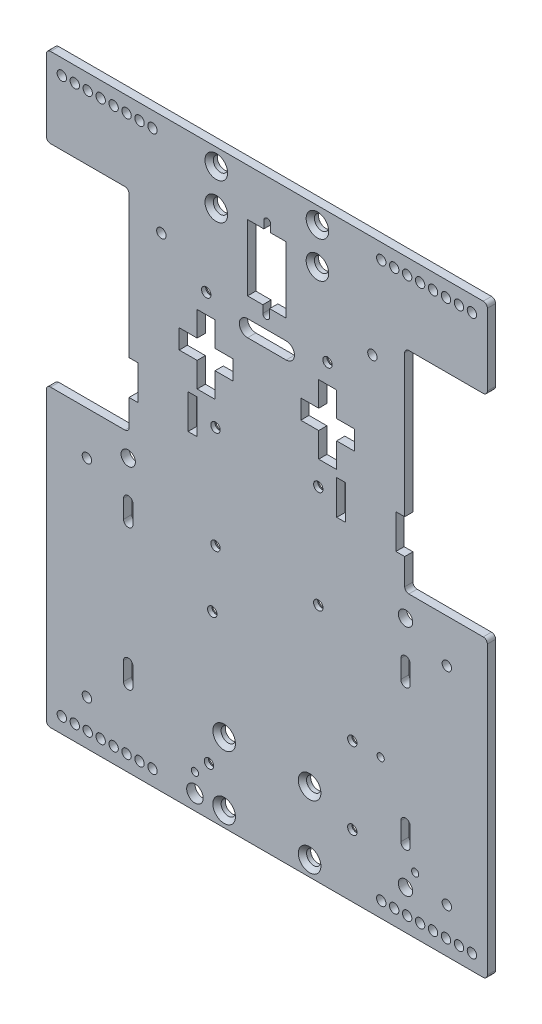
from build123d import *

# Parameters (mm, degrees)
BOSS_EXTRUDE1_DEPTH = 3
SKETCH2_R           = 1.7
CUT_EXTRUDE1_DEPTH  = 3
SKETCH3_R           = 1.7
CUT_EXTRUDE2_DEPTH  = 3
SKETCH4_R           = 1.7
CUT_EXTRUDE3_DEPTH  = 3
CUT_EXTRUDE6_DEPTH  = 3
FILLET1_R           = 1.5
FILLET2_R           = 1.5
SKETCH7_R           = 2.6
CUT_EXTRUDE7_DEPTH  = 3
SKETCH8_W           = 3.2
SKETCH8_H           = 12.5
CUT_EXTRUDE9_DEPTH  = 3
SKETCH9_W           = 3.25
SKETCH9_H           = 12.5
CUT_EXTRUDE10_DEPTH = 3
CUT_EXTRUDE12_DEPTH = 3
SKETCH11_R          = 1.7
CUT_EXTRUDE14_DEPTH = 3
SKETCH12_R          = 1.7
CUT_EXTRUDE16_DEPTH = 3
SKETCH13_R          = 1.7
CUT_EXTRUDE18_DEPTH = 3
SKETCH14_R          = 1.3
CUT_EXTRUDE20_DEPTH = 3
SKETCH15_R          = 2.6
CUT_EXTRUDE21_DEPTH = 10
SKETCH16_R          = 3
SKETCH16_R_2        = 1.3
CUT_EXTRUDE24_DEPTH = 10
CHAMFER1_SIZE       = 1.5
CHAMFER2_SIZE       = 1.5
CHAMFER3_SIZE       = 1.5
CHAMFER4_SIZE       = 1.5
CHAMFER5_SIZE       = 1.5
CHAMFER6_SIZE       = 1.5
CHAMFER7_SIZE       = 1.5
CHAMFER8_SIZE       = 1.5
CHAMFER9_SIZE       = 1.5
CHAMFER10_SIZE      = 1.5
CHAMFER11_SIZE      = 1.5
CHAMFER12_SIZE      = 1.5
SKETCH17_R          = 2.6
CUT_EXTRUDE27_DEPTH = 10
FILLET3_R           = 1.5
FILLET4_R           = 1.5
CHAMFER13_SIZE      = 1.5
CHAMFER14_SIZE      = 1.5
CHAMFER15_SIZE      = 1.5
CHAMFER16_SIZE      = 1.5
CHAMFER17_SIZE      = 1.5
CHAMFER18_SIZE      = 1.5
FILLET5_R           = 1.5
FILLET6_R           = 1.5
FILLET7_R           = 1.5
FILLET8_R           = 1.5


with BuildPart() as part:
    # Sketch1 → Boss-Extrude1 (new body)
    with BuildSketch(Plane.XY):
        Polygon((-80, -100.362745098), (80, -100.362745098), (80, 6.637254902), (50, 6.637254902), (50, 83.137254902), (80, 83.137254902), (80, 112.137254902), (-80, 112.137254902), (-80, 83.137254902), (-50, 83.137254902), (-50, 6.637254902), (-80, 6.637254902), align=None)
    extrude(amount=BOSS_EXTRUDE1_DEPTH)

    # Sketch2 → Cut-Extrude1 (cut)
    with BuildSketch(Plane(origin=(0, 0, 0), x_dir=(-1, 0, 0), z_dir=(0, 0, -1))):
        with Locations((38.27958447, 75.137254902)):
            Circle(SKETCH2_R)
        with Locations((-38.27958447, 75.137254902)):
            Circle(SKETCH2_R)
        with BuildLine():
            Line((-7, 95.04531444), (-1.373901732, 95.04531444))
            Line((-1.373901732, 95.04531444), (-1.373901732, 97.778273136))
            ThreePointArc((-1.373901732, 97.778273136), (-0.139792235, 99.012382633), (1.094317261, 97.778273136))
            Line((1.094317261, 97.778273136), (1.094317261, 95.04531444))
            Line((1.094317261, 95.04531444), (7, 95.04531444))
            Line((7, 95.04531444), (7, 71.04531444))
            Line((7, 71.04531444), (1.469744896, 71.04531444))
            Line((1.469744896, 71.04531444), (1.469744896, 68.312355743))
            ThreePointArc((1.469744896, 68.312355743), (0.235635399, 67.078246247), (-0.998474097, 68.312355743))
            Line((-0.998474097, 68.312355743), (-0.998474097, 71.04531444))
            Line((-0.998474097, 71.04531444), (-7, 71.04531444))
            Line((-7, 71.04531444), (-7, 95.04531444))
        make_face()
    extrude(amount=-CUT_EXTRUDE1_DEPTH, mode=Mode.SUBTRACT)

    # Sketch3 → Cut-Extrude2 (cut)
    with BuildSketch(Plane.XY.offset(3)):
        with Locations((-22, 64.68040086)):
            Circle(SKETCH3_R)
        with Locations((22, 64.68040086)):
            Circle(SKETCH3_R)
        with BuildLine():
            Line((-7, 63.896376565), (7, 63.896376565))
            ThreePointArc((7, 63.896376565), (10, 60.896376565), (7, 57.896376565))
            Line((7, 57.896376565), (-7, 57.896376565))
            ThreePointArc((-7, 57.896376565), (-10, 60.896376565), (-7, 63.896376565))
        make_face()
    extrude(amount=-CUT_EXTRUDE2_DEPTH, mode=Mode.SUBTRACT)

    # Sketch4 → Cut-Extrude3 (cut)
    with BuildSketch(Plane.XY.offset(3)):
        with Locations((74.4, 106.537254902)):
            Circle(SKETCH4_R)
        with Locations((69.7, 106.537254902)):
            Circle(SKETCH4_R)
        with Locations((65, 106.537254902)):
            Circle(SKETCH4_R)
        with Locations((60.3, 106.537254902)):
            Circle(SKETCH4_R)
        with Locations((55.6, 106.537254902)):
            Circle(SKETCH4_R)
        with Locations((50.9, 106.537254902)):
            Circle(SKETCH4_R)
        with Locations((46.2, 106.537254902)):
            Circle(SKETCH4_R)
        with Locations((41.5, 106.537254902)):
            Circle(SKETCH4_R)
        with Locations((-74.4, 106.537254902)):
            Circle(SKETCH4_R)
        with Locations((-69.7, 106.537254902)):
            Circle(SKETCH4_R)
        with Locations((-65, 106.537254902)):
            Circle(SKETCH4_R)
        with Locations((-60.3, 106.537254902)):
            Circle(SKETCH4_R)
        with Locations((-55.6, 106.537254902)):
            Circle(SKETCH4_R)
        with Locations((-50.9, 106.537254902)):
            Circle(SKETCH4_R)
        with Locations((-46.2, 106.537254902)):
            Circle(SKETCH4_R)
        with Locations((-41.5, 106.537254902)):
            Circle(SKETCH4_R)
        with Locations((-74.4, -94.762745098)):
            Circle(SKETCH4_R)
        with Locations((-69.7, -94.762745098)):
            Circle(SKETCH4_R)
        with Locations((-65, -94.762745098)):
            Circle(SKETCH4_R)
        with Locations((-60.3, -94.762745098)):
            Circle(SKETCH4_R)
        with Locations((-55.6, -94.762745098)):
            Circle(SKETCH4_R)
        with Locations((-50.9, -94.762745098)):
            Circle(SKETCH4_R)
        with Locations((-46.2, -94.762745098)):
            Circle(SKETCH4_R)
        with Locations((-41.5, -94.762745098)):
            Circle(SKETCH4_R)
        with Locations((41.5, -94.762745098)):
            Circle(SKETCH4_R)
        with Locations((46.2, -94.762745098)):
            Circle(SKETCH4_R)
        with Locations((50.9, -94.762745098)):
            Circle(SKETCH4_R)
        with Locations((55.6, -94.762745098)):
            Circle(SKETCH4_R)
        with Locations((60.3, -94.762745098)):
            Circle(SKETCH4_R)
        with Locations((65, -94.762745098)):
            Circle(SKETCH4_R)
        with Locations((69.7, -94.762745098)):
            Circle(SKETCH4_R)
        with Locations((74.4, -94.762745098)):
            Circle(SKETCH4_R)
    extrude(amount=-CUT_EXTRUDE3_DEPTH, mode=Mode.SUBTRACT)

    # Sketch6 → Cut-Extrude6 (cut)
    with BuildSketch(Plane.XY):
        Polygon((25.3, 57.637254902), (18.8, 57.637254902), (18.8, 48.637254902), (12.3, 48.637254902), (12.3, 41.637254902), (18.8, 41.637254902), (18.8, 32.637254902), (25.3, 32.637254902), (25.3, 41.637254902), (31.8, 41.637254902), (31.8, 48.637254902), (25.3, 48.637254902), align=None)
        Polygon((-31.8, 48.637254902), (-25.3, 48.637254902), (-25.3, 57.637254902), (-18.8, 57.637254902), (-18.8, 48.637254902), (-12.3, 48.637254902), (-12.3, 41.637254902), (-18.8, 41.637254902), (-18.8, 32.637254902), (-25.3, 32.637254902), (-25.3, 41.637254902), (-31.8, 41.637254902), align=None)
    extrude(amount=CUT_EXTRUDE6_DEPTH, mode=Mode.SUBTRACT)

    # Fillet1
    fillet1_edges = [part.edges().sort_by_distance(p)[0] for p in [
        (80, 83.137254902, 1.5),
        (80, 112.137254902, 1.5),
        (-80, 112.137254902, 1.5),
        (-80, 83.137254902, 1.5),
    ]]
    fillet(fillet1_edges, radius=FILLET1_R)

    # Fillet2
    fillet2_edges = [part.edges().sort_by_distance(p)[0] for p in [
        (80, -100.362745098, 1.5),
        (-80, -100.362745098, 1.5),
    ]]
    fillet(fillet2_edges, radius=FILLET2_R)

    # Sketch7 → Cut-Extrude7 (cut)
    with BuildSketch(Plane.XY.offset(3)):
        with Locations((-15.5, -94.862745098)):
            Circle(SKETCH7_R)
        with Locations((-15.5, -71.862745098)):
            Circle(SKETCH7_R)
        with Locations((15.5, -94.862745098)):
            Circle(SKETCH7_R)
        with Locations((15.5, -71.862745098)):
            Circle(SKETCH7_R)
    extrude(amount=-CUT_EXTRUDE7_DEPTH, mode=Mode.SUBTRACT)

    # Sketch8 → Cut-Extrude9 (cut)
    with BuildSketch(Plane.XY):
        with Locations((-48.4, 23.887254902)):
            Rectangle(SKETCH8_W, SKETCH8_H)
        with Locations((48.4, 23.887254902)):
            Rectangle(SKETCH8_W, SKETCH8_H)
    extrude(amount=CUT_EXTRUDE9_DEPTH, mode=Mode.SUBTRACT)

    # Sketch9 → Cut-Extrude10 (cut)
    with BuildSketch(Plane.XY.offset(3)):
        with Locations((-26.975, 23.887254902)):
            Rectangle(SKETCH9_W, SKETCH9_H)
        with Locations((26.975, 23.887254902)):
            Rectangle(SKETCH9_W, SKETCH9_H)
    extrude(amount=-CUT_EXTRUDE10_DEPTH, mode=Mode.SUBTRACT)

    # Sketch10 → Cut-Extrude12 (cut)
    with BuildSketch(Plane.XY):
        with BuildLine():
            Line((-48.6, -15.062745098), (-48.6, -21.662745098))
            ThreePointArc((-48.6, -21.662745098), (-50.3, -23.362745098), (-52, -21.662745098))
            Line((-52, -21.662745098), (-52, -15.062745098))
            ThreePointArc((-52, -15.062745098), (-50.3, -13.362745098), (-48.6, -15.062745098))
        make_face()
        with BuildLine():
            Line((-52, -66.062745098), (-52, -72.662745098))
            ThreePointArc((-52, -72.662745098), (-50.3, -74.362745098), (-48.6, -72.662745098))
            Line((-48.6, -72.662745098), (-48.6, -66.062745098))
            ThreePointArc((-48.6, -66.062745098), (-50.3, -64.362745098), (-52, -66.062745098))
        make_face()
        with BuildLine():
            Line((48.6, -66.062745098), (48.6, -72.662745098))
            ThreePointArc((48.6, -72.662745098), (50.3, -74.362745098), (52, -72.662745098))
            Line((52, -72.662745098), (52, -66.062745098))
            ThreePointArc((52, -66.062745098), (50.3, -64.362745098), (48.6, -66.062745098))
        make_face()
        with BuildLine():
            Line((48.6, -15.062745098), (48.6, -21.662745098))
            ThreePointArc((48.6, -21.662745098), (50.3, -23.362745098), (52, -21.662745098))
            Line((52, -21.662745098), (52, -15.062745098))
            ThreePointArc((52, -15.062745098), (50.3, -13.362745098), (48.6, -15.062745098))
        make_face()
    extrude(amount=CUT_EXTRUDE12_DEPTH, mode=Mode.SUBTRACT)

    # Sketch11 → Cut-Extrude14 (cut)
    with BuildSketch(Plane.XY):
        with Locations((-18.65, 23.887254902)):
            Circle(SKETCH11_R)
        with Locations((-18.65, -13.312745098)):
            Circle(SKETCH11_R)
        with Locations((18.65, -13.312745098)):
            Circle(SKETCH11_R)
        with Locations((18.65, 23.887254902)):
            Circle(SKETCH11_R)
    extrude(amount=CUT_EXTRUDE14_DEPTH, mode=Mode.SUBTRACT)

    # Sketch12 → Cut-Extrude16 (cut)
    with BuildSketch(Plane.XY):
        with Locations((65.3, -9.062745098)):
            Circle(SKETCH12_R)
        with Locations((-65.3, -9.062745098)):
            Circle(SKETCH12_R)
        with Locations((65.3, -84.162745098)):
            Circle(SKETCH12_R)
        with Locations((-65.3, -84.162745098)):
            Circle(SKETCH12_R)
    extrude(amount=CUT_EXTRUDE16_DEPTH, mode=Mode.SUBTRACT)

    # Sketch13 → Cut-Extrude18 (cut)
    with BuildSketch(Plane.XY):
        with Locations((-21, -82.862745098)):
            Circle(SKETCH13_R)
        with Locations((31, -77.662745098)):
            Circle(SKETCH13_R)
        with Locations((31, -49.762745098)):
            Circle(SKETCH13_R)
        with Locations((-19.8, -34.562745098)):
            Circle(SKETCH13_R)
    extrude(amount=CUT_EXTRUDE18_DEPTH, mode=Mode.SUBTRACT)

    # Sketch14 → Cut-Extrude20 (cut)
    with BuildSketch(Plane.XY):
        with Locations((53.8, -79.762745098)):
            Circle(SKETCH14_R)
        with Locations((41.3, -49.762745098)):
            Circle(SKETCH14_R)
    extrude(amount=CUT_EXTRUDE20_DEPTH, mode=Mode.SUBTRACT)

    # Sketch15 → Cut-Extrude21 (cut)
    with BuildSketch(Plane.XY):
        with Locations((50.3, -1.562745098)):
            Circle(SKETCH15_R)
        with Locations((-50.3, -1.562745098)):
            Circle(SKETCH15_R)
        with Locations((50.3, -86.162745098)):
            Circle(SKETCH15_R)
    extrude(amount=CUT_EXTRUDE21_DEPTH, mode=Mode.SUBTRACT)

    # Sketch16 → Cut-Extrude24 (cut)
    with BuildSketch(Plane.XY.offset(3)):
        with Locations((-26.1, -94.862745098)):
            Circle(SKETCH16_R)
        with Locations((-26.1, -88.062745098)):
            Circle(SKETCH16_R_2)
    extrude(amount=-CUT_EXTRUDE24_DEPTH, mode=Mode.SUBTRACT)

    # Chamfer1
    chamfer1_edges = [part.edges().sort_by_distance(p)[0] for p in [
        (-18.1, -71.862745098, 3),
    ]]
    chamfer(chamfer1_edges, length=CHAMFER1_SIZE)

    # Chamfer2
    chamfer2_edges = [part.edges().sort_by_distance(p)[0] for p in [
        (12.9, -71.862745098, 3),
    ]]
    chamfer(chamfer2_edges, length=CHAMFER2_SIZE)

    # Chamfer3
    chamfer3_edges = [part.edges().sort_by_distance(p)[0] for p in [
        (-18.1, -94.862745098, 3),
    ]]
    chamfer(chamfer3_edges, length=CHAMFER3_SIZE)

    # Chamfer4
    chamfer4_edges = [part.edges().sort_by_distance(p)[0] for p in [
        (12.9, -94.862745098, 3),
    ]]
    chamfer(chamfer4_edges, length=CHAMFER4_SIZE)

    # Chamfer5
    chamfer5_edges = [part.edges().sort_by_distance(p)[0] for p in [
        (16.95, 23.887254902, 0),
    ]]
    chamfer(chamfer5_edges, length=CHAMFER5_SIZE)

    # Chamfer6
    chamfer6_edges = [part.edges().sort_by_distance(p)[0] for p in [
        (-20.35, 23.887254902, 0),
    ]]
    chamfer(chamfer6_edges, length=CHAMFER6_SIZE)

    # Chamfer7
    chamfer7_edges = [part.edges().sort_by_distance(p)[0] for p in [
        (16.95, -13.312745098, 0),
    ]]
    chamfer(chamfer7_edges, length=CHAMFER7_SIZE)

    # Chamfer8
    chamfer8_edges = [part.edges().sort_by_distance(p)[0] for p in [
        (-20.35, -13.312745098, 0),
    ]]
    chamfer(chamfer8_edges, length=CHAMFER8_SIZE)

    # Chamfer9
    chamfer9_edges = [part.edges().sort_by_distance(p)[0] for p in [
        (-21.5, -34.562745098, 0),
    ]]
    chamfer(chamfer9_edges, length=CHAMFER9_SIZE)

    # Chamfer10
    chamfer10_edges = [part.edges().sort_by_distance(p)[0] for p in [
        (29.3, -49.762745098, 0),
    ]]
    chamfer(chamfer10_edges, length=CHAMFER10_SIZE)

    # Chamfer11
    chamfer11_edges = [part.edges().sort_by_distance(p)[0] for p in [
        (29.3, -77.662745098, 0),
    ]]
    chamfer(chamfer11_edges, length=CHAMFER11_SIZE)

    # Chamfer12
    chamfer12_edges = [part.edges().sort_by_distance(p)[0] for p in [
        (-22.7, -82.862745098, 0),
    ]]
    chamfer(chamfer12_edges, length=CHAMFER12_SIZE)

    # Sketch17 → Cut-Extrude27 (cut)
    with BuildSketch(Plane.XY):
        with Locations((-18.35, 106.037254902)):
            Circle(SKETCH17_R)
        with Locations((-18.35, 92.837254902)):
            Circle(SKETCH17_R)
        with Locations((18.35, 92.837254902)):
            Circle(SKETCH17_R)
        with Locations((18.35, 106.037254902)):
            Circle(SKETCH17_R)
    extrude(amount=CUT_EXTRUDE27_DEPTH, mode=Mode.SUBTRACT)

    # Fillet3
    fillet3_edges = [part.edges().sort_by_distance(p)[0] for p in [
        (80, 6.637254902, 1.5),
    ]]
    fillet(fillet3_edges, radius=FILLET3_R)

    # Fillet4
    fillet4_edges = [part.edges().sort_by_distance(p)[0] for p in [
        (-80, 6.637254902, 1.5),
    ]]
    fillet(fillet4_edges, radius=FILLET4_R)

    # Chamfer13
    chamfer13_edges = [part.edges().sort_by_distance(p)[0] for p in [
        (-20.95, 106.037254902, 3),
    ]]
    chamfer(chamfer13_edges, length=CHAMFER13_SIZE)

    # Chamfer14
    chamfer14_edges = [part.edges().sort_by_distance(p)[0] for p in [
        (15.75, 106.037254902, 3),
    ]]
    chamfer(chamfer14_edges, length=CHAMFER14_SIZE)

    # Chamfer15
    chamfer15_edges = [part.edges().sort_by_distance(p)[0] for p in [
        (-20.95, 92.837254902, 3),
    ]]
    chamfer(chamfer15_edges, length=CHAMFER15_SIZE)

    # Chamfer16
    chamfer16_edges = [part.edges().sort_by_distance(p)[0] for p in [
        (15.75, 92.837254902, 3),
    ]]
    chamfer(chamfer16_edges, length=CHAMFER16_SIZE)

    # Chamfer17
    chamfer17_edges = [part.edges().sort_by_distance(p)[0] for p in [
        (-23.7, 64.68040086, 0),
    ]]
    chamfer(chamfer17_edges, length=CHAMFER17_SIZE)

    # Chamfer18
    chamfer18_edges = [part.edges().sort_by_distance(p)[0] for p in [
        (20.3, 64.68040086, 0),
    ]]
    chamfer(chamfer18_edges, length=CHAMFER18_SIZE)

    # Fillet5
    fillet5_edges = [part.edges().sort_by_distance(p)[0] for p in [
        (50, 6.637254902, 1.5),
    ]]
    fillet(fillet5_edges, radius=FILLET5_R)

    # Fillet6
    fillet6_edges = [part.edges().sort_by_distance(p)[0] for p in [
        (50, 83.137254902, 1.5),
    ]]
    fillet(fillet6_edges, radius=FILLET6_R)

    # Fillet7
    fillet7_edges = [part.edges().sort_by_distance(p)[0] for p in [
        (-50, 83.137254902, 1.5),
    ]]
    fillet(fillet7_edges, radius=FILLET7_R)

    # Fillet8
    fillet8_edges = [part.edges().sort_by_distance(p)[0] for p in [
        (-50, 6.637254902, 1.5),
    ]]
    fillet(fillet8_edges, radius=FILLET8_R)


solid = part.part
